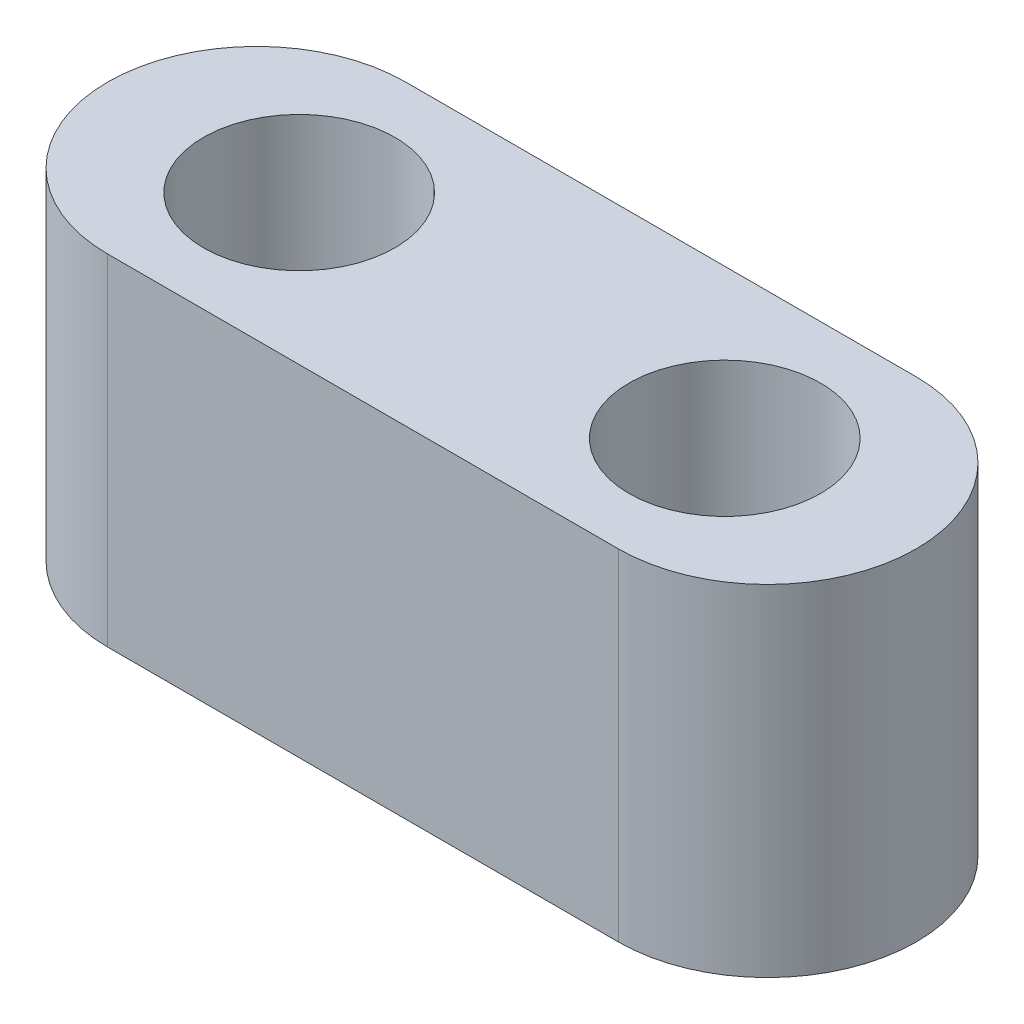
from build123d import *

# Parameters (mm, degrees)
SKETCH1_R           = 2.25
BOSS_EXTRUDE1_DEPTH = 8


with BuildPart() as part:
    # Sketch1 → Boss-Extrude1 (new body)
    with BuildSketch(Plane(origin=(0, 0, 0), x_dir=(1, 0, 0), z_dir=(0, 1, 0))):
        with BuildLine():
            Line((-6, -3.5), (6, -3.5))
            ThreePointArc((6, -3.5), (9.5, 0), (6, 3.5))
            Line((6, 3.5), (-6, 3.5))
            ThreePointArc((-6, 3.5), (-9.5, 0), (-6, -3.5))
        make_face()
        with Locations((5, 0)):
            Circle(SKETCH1_R, mode=Mode.SUBTRACT)
        with Locations((-5, 0)):
            Circle(SKETCH1_R, mode=Mode.SUBTRACT)
    extrude(amount=BOSS_EXTRUDE1_DEPTH)


solid = part.part
